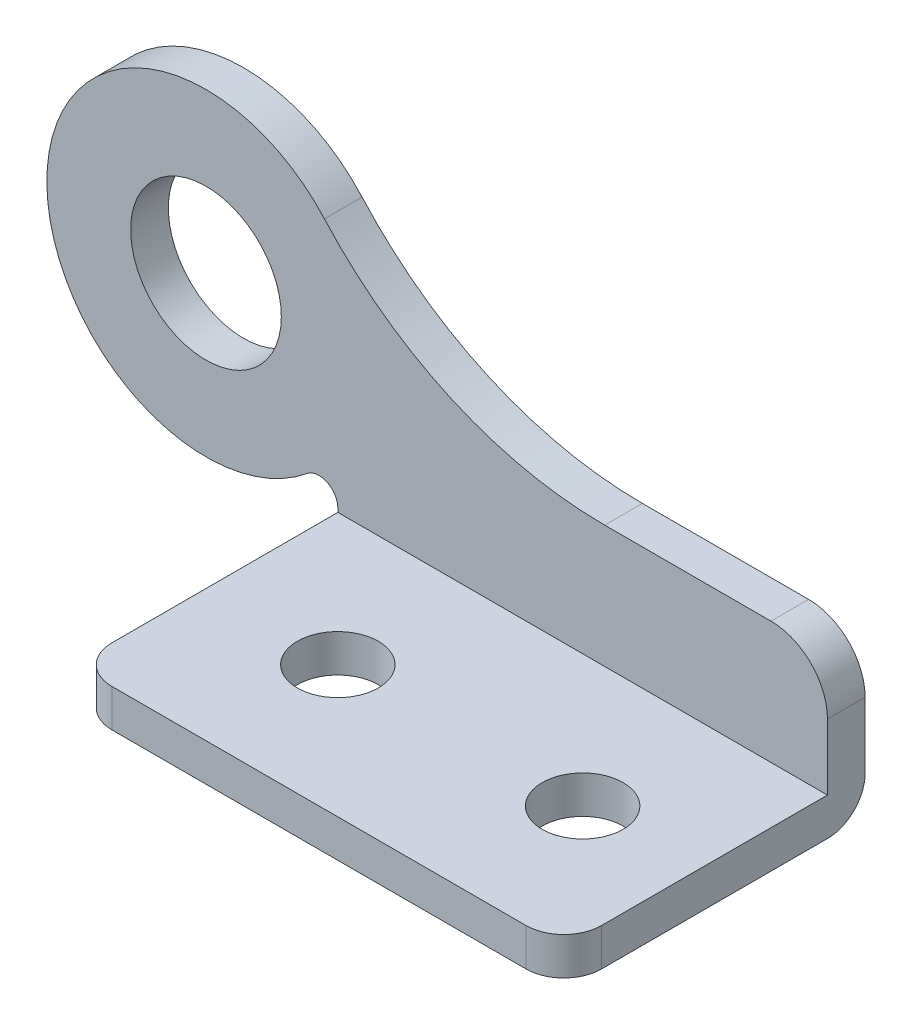
from build123d import *

# Parameters (mm, degrees)
SKETCH_1_R      = 4
EXTRUDE_1_DEPTH = 2
SKETCH_2_R      = 2.15
EXTRUDE_2_DEPTH = 2
FILLET_1_R      = 2


with BuildPart() as part:
    # 草图1 → 凸台-拉伸1 (new body)
    with BuildSketch(Plane.XY):
        with BuildLine():
            ThreePointArc((-7.093271049, -20.287577169), (-6.031103785, -20.156019414), (-5.458350415, -21.060154535))
            Line((-5.458350415, -21.060154535), (-5.458350415, -21.259298421))
            Line((-5.458350415, -21.259298421), (-5.458350415, -23.259298421))
            Line((-5.458350415, -23.259298421), (20.541649585, -23.259298421))
            Line((20.541649585, -23.259298421), (20.541649585, -17.759298421))
            ThreePointArc((20.541649585, -17.759298421), (19.662969929, -15.637978077), (17.541649585, -14.759298421))
            Line((17.541649585, -14.759298421), (8.717166108, -14.759298421))
            ThreePointArc((8.717166108, -14.759298421), (0.566562607, -13.023133247), (-6.1689615, -8.116064678))
            ThreePointArc((-6.1689615, -8.116064678), (-20.884089955, -13.119444375), (-7.093271049, -20.287577169))
        make_face()
        with Locations((-12.458350415, -13.759298421)):
            Circle(SKETCH_1_R, mode=Mode.SUBTRACT)
    extrude(amount=EXTRUDE_1_DEPTH)

    # 草图2 → 凸台-拉伸2 (add)
    with BuildSketch(Plane.XZ.offset(23.259298421)):
        with BuildLine():
            Line((18.541649585, 16), (-3.458350415, 16))
            ThreePointArc((-3.458350415, 16), (-4.872563977, 15.414213562), (-5.458350415, 14))
            Line((-5.458350415, 14), (-5.458350415, 2))
            Line((-5.458350415, 2), (-5.458350415, 0))
            Line((-5.458350415, 0), (20.541649585, 0))
            Line((20.541649585, 0), (20.541649585, 14))
            ThreePointArc((20.541649585, 14), (19.955863148, 15.414213562), (18.541649585, 16))
        make_face()
        with Locations((1.541649585, 9)):
            Circle(SKETCH_2_R, mode=Mode.SUBTRACT)
        with BuildLine():
            ThreePointArc((16.691649585, 9), (15.139618066, 11.06517159), (12.724269403, 10.148751179))
            ThreePointArc((12.724269403, 10.148751179), (13.943681105, 6.93482841), (16.691649585, 9))
        make_face(mode=Mode.SUBTRACT)
    extrude(amount=-EXTRUDE_2_DEPTH)

    # 圆角1
    fillet_1_edges = [part.edges().sort_by_distance(p)[0] for p in [
        (7.541649585, -23.259298421, 0),
    ]]
    fillet(fillet_1_edges, radius=FILLET_1_R)


solid = part.part
